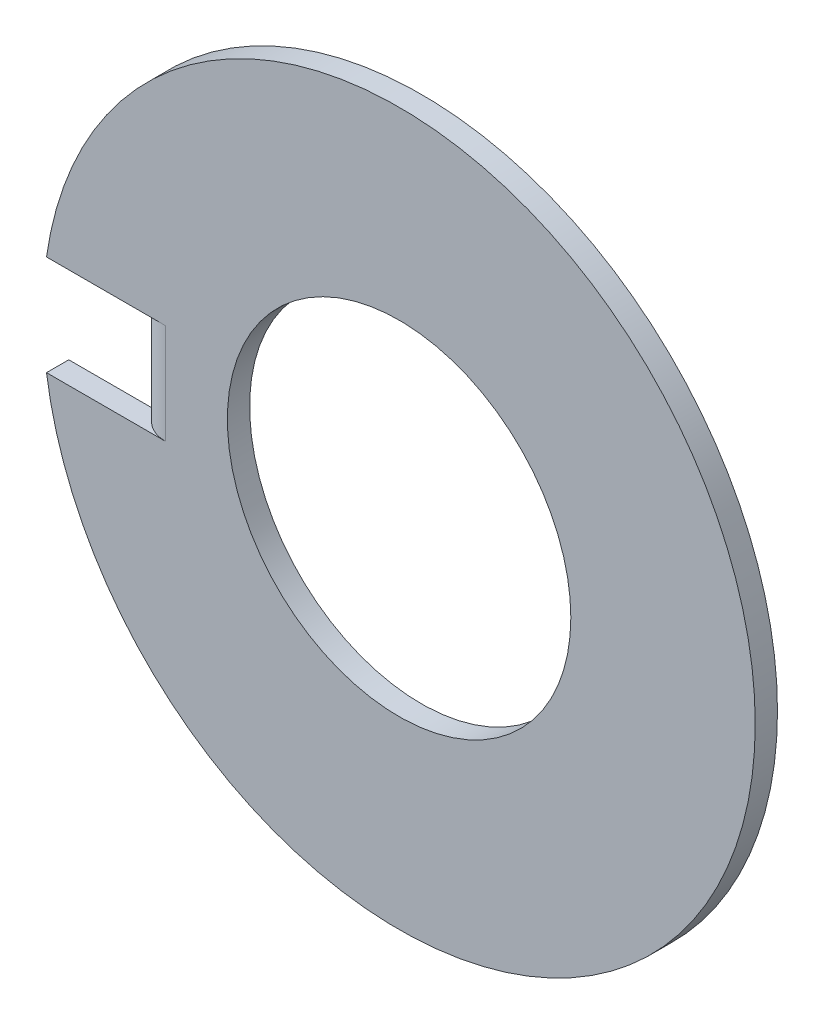
from build123d import *

# Parameters (mm, degrees)
SKETCH1_R                    = 7.715
BASE_FLANGE1_DEPTH           = 1
EDGE_FLANGE1_STRIP_W         = 5
EDGE_FLANGE1_STRIP_H         = 1
EDGE_FLANGE1_STRIP_CUT_DEPTH = 4.5
EDGE_FLANGE1_DEPTH           = 4.5


# Sheet-metal steps are written as plain solids
with BuildPart() as part:
    # Sketch1 → Base-Flange1 (new body)
    with BuildSketch(Plane.XY):
        with BuildLine():
            Line((-15.841006912, 2.25), (-12, 2.25))
            Line((-12, 2.25), (-12, -2.25))
            Line((-12, -2.25), (-15.841006912, -2.25))
            ThreePointArc((-15.841006912, -2.25), (16, 0), (-15.841006912, 2.25))
        make_face()
        Circle(SKETCH1_R, mode=Mode.SUBTRACT)
    extrude(amount=BASE_FLANGE1_DEPTH)

    # Edge-Flange1 strip (across the edge) → Edge-Flange1 strip cut (cut)
    with BuildSketch(Plane(origin=(-12, -2.25, 0), x_dir=(1, 0, 0), z_dir=(0, 1, 0))):
        with Locations((-1, -0.5)):
            Rectangle(EDGE_FLANGE1_STRIP_W, EDGE_FLANGE1_STRIP_H)
    extrude(amount=EDGE_FLANGE1_STRIP_CUT_DEPTH, mode=Mode.SUBTRACT)

    # Edge-Flange1 section (across the edge) → Edge-Flange1 (add)
    with BuildSketch(Plane(origin=(-12, -2.25, 0), x_dir=(1, 0, 0), z_dir=(0, 1, 0))):
        with BuildLine():
            Line((0, 0.5), (0, 3))
            Line((0, 3), (1, 3))
            Line((1, 3), (1, 0.5))
            ThreePointArc((1, 0.5), (1.146446609, 0.146446609), (1.5, 0))
            Line((1.5, 0), (1.5, -1))
            ThreePointArc((1.5, -1), (0.439339828, -0.560660172), (0, 0.5))
        make_face()
    extrude(amount=EDGE_FLANGE1_DEPTH)


solid = part.part
